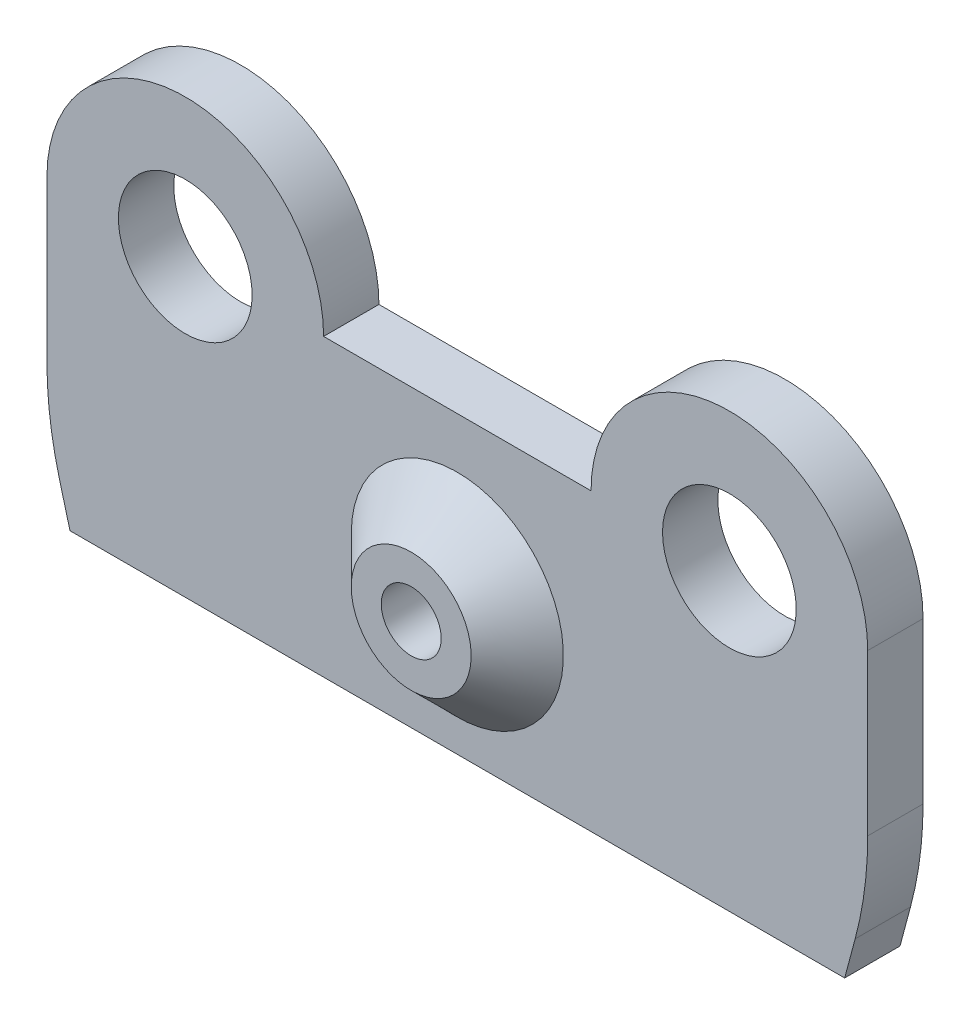
from build123d import *

# Parameters (mm, degrees)
SKETCH1_R           = 7.25
SKETCH1_R_2         = 3.25
BOSS_EXTRUDE1_DEPTH = 6
SKETCH2_R           = 6.5
SKETCH2_R_2         = 3.25
BOSS_EXTRUDE2_DEPTH = 5
CHAMFER1_SIZE       = 5
CHAMFER2_SIZE       = 2.5
CHAMFER2_SIZE2      = 9.330127019
FILLET1_R           = 40
CHAMFER3_SIZE       = 2.5
CHAMFER3_SIZE2      = 9.330127019
FILLET2_R           = 40


with BuildPart() as part:
    # Sketch1 → Boss-Extrude1 (new body)
    with BuildSketch(Plane.XY):
        with BuildLine():
            Line((-44.5, 0), (-44.5, -32))
            Line((-44.5, -32), (44.5, -32))
            Line((44.5, -32), (44.5, 0))
            ThreePointArc((44.5, 0), (29.5, 15), (14.5, 0))
            Line((14.5, 0), (-14.5, 0))
            ThreePointArc((-14.5, 0), (-29.5, 15), (-44.5, 0))
        make_face()
        with Locations((-29.5, 0)):
            Circle(SKETCH1_R, mode=Mode.SUBTRACT)
        with Locations(Location((29.5, 0, 0), (0, 0, 180))):
            Circle(SKETCH1_R, mode=Mode.SUBTRACT)
        with Locations((0, -17)):
            Circle(SKETCH1_R_2, mode=Mode.SUBTRACT)
    extrude(amount=BOSS_EXTRUDE1_DEPTH)

    # Sketch2 → Boss-Extrude2 (add)
    with BuildSketch(Plane.XY.offset(6)):
        with Locations(Location((0, -17, 0), (0, 0, 180))):
            Circle(SKETCH2_R)
        with Locations((0, -17)):
            Circle(SKETCH2_R_2, mode=Mode.SUBTRACT)
    extrude(amount=BOSS_EXTRUDE2_DEPTH)

    # Chamfer1
    chamfer1_edges = [part.edges().sort_by_distance(p)[0] for p in [
        (6.5, -17, 6),
    ]]
    chamfer(chamfer1_edges, length=CHAMFER1_SIZE - 0.0001)  # a hair under: the kernel refuses the full size

    # Chamfer2
    chamfer2_edges = [part.edges().sort_by_distance(p)[0] for p in [
        (-44.5, -32, 3),
    ]]
    chamfer2_side = [part.faces().sort_by_distance(p)[0] for p in [
        (0, -32, 3),
    ]]
    chamfer(chamfer2_edges, length=CHAMFER2_SIZE, length2=CHAMFER2_SIZE2, reference=chamfer2_side[0])

    # Fillet1
    fillet1_edges = [part.edges().sort_by_distance(p)[0] for p in [
        (-44.5, -22.669872981, 3),
    ]]
    fillet(fillet1_edges, radius=FILLET1_R)

    # Chamfer3
    chamfer3_edges = [part.edges().sort_by_distance(p)[0] for p in [
        (44.5, -32, 3),
    ]]
    chamfer3_side = [part.faces().sort_by_distance(p)[0] for p in [
        (1.25, -32, 3),
    ]]
    chamfer(chamfer3_edges, length=CHAMFER3_SIZE, length2=CHAMFER3_SIZE2, reference=chamfer3_side[0])

    # Fillet2
    fillet2_edges = [part.edges().sort_by_distance(p)[0] for p in [
        (44.5, -22.669872981, 3),
    ]]
    fillet(fillet2_edges, radius=FILLET2_R)


solid = part.part
